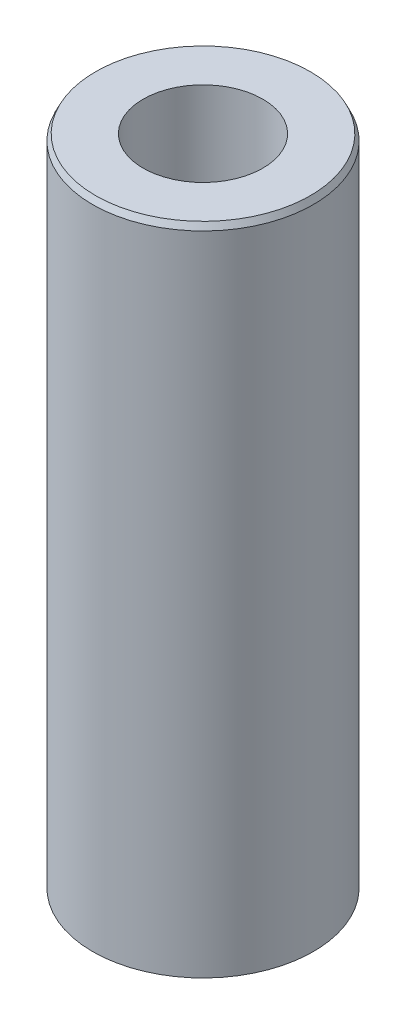
from build123d import *
from OCP.BRepFilletAPI import BRepFilletAPI_MakeChamfer

# Parameters (mm, degrees)
SKETCH1_R           = 17.5
BOSS_EXTRUDE1_DEPTH = 104.01375239
SKETCH2_R           = 9.485432871
CUT_EXTRUDE1_DEPTH  = 107.917541527
CHAMFER1_SIZE       = 0.989470447
CHAMFER1_SIZE2      = 0.475843319


with BuildPart() as part:
    # Sketch1 → Boss-Extrude1 (new body)
    with BuildSketch(Plane(origin=(0, 0, 0), x_dir=(1, 0, 0), z_dir=(0, 1, 0))):
        Circle(SKETCH1_R)
    extrude(amount=BOSS_EXTRUDE1_DEPTH)

    # Sketch2 → Cut-Extrude1 (cut, through all)
    with BuildSketch(Plane(origin=(0, 0, 0), x_dir=(1, 0, 0), z_dir=(0, 1, 0))):
        Circle(SKETCH2_R)
    extrude(amount=CUT_EXTRUDE1_DEPTH, mode=Mode.SUBTRACT)

    # Chamfer1: one chamfer whose edges measure the first distance from different faces: ONE call of the kernel's chamfer builder (chamfer() names one face for all edges)
    chamfer1_edges_1 = [part.edges().sort_by_distance(p)[0] for p in [
        (-17.5, 104.01375239, 0),
    ]]
    chamfer1_side_1 = [part.faces().sort_by_distance(p)[0] for p in [
        (-17.5, 52.006876195, 0),
    ]]
    chamfer1_edges_2 = [part.edges().sort_by_distance(p)[0] for p in [
        (-17.5, 0, 0),
    ]]
    chamfer1_side_2 = [part.faces().sort_by_distance(p)[0] for p in [
        (-17.005025253, 0, 0),
    ]]
    chamfer1 = BRepFilletAPI_MakeChamfer(part.part.solid().wrapped)
    for e in chamfer1_edges_1:
        chamfer1.Add(CHAMFER1_SIZE, CHAMFER1_SIZE2, e.wrapped, chamfer1_side_1[0].wrapped)  # the first distance lies on this face
    for e in chamfer1_edges_2:
        chamfer1.Add(CHAMFER1_SIZE, CHAMFER1_SIZE2, e.wrapped, chamfer1_side_2[0].wrapped)  # the first distance lies on this face
    add(Compound.cast(chamfer1.Shape()), mode=Mode.REPLACE)


solid = part.part
